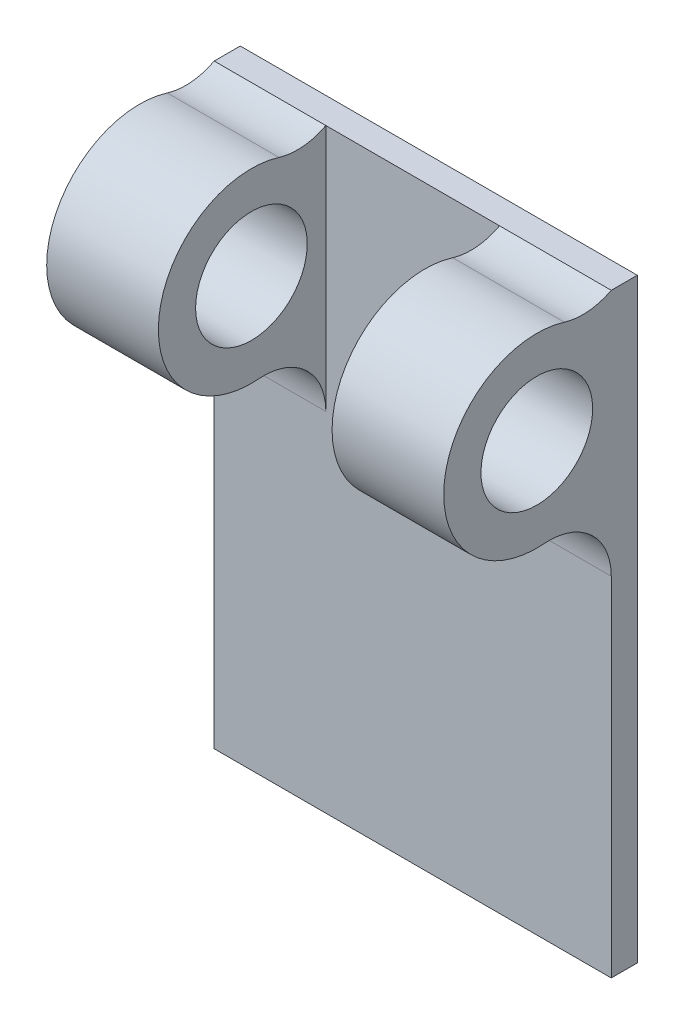
from build123d import *

# Parameters (mm, degrees)
SKETCH1_W           = 640
SKETCH1_H           = 960
BOSS_EXTRUDE1_DEPTH = 42
SKETCH2_R           = 150
SKETCH2_R_2         = 90
BOSS_EXTRUDE2_DEPTH = 640
FILLET1_R           = 100
SKETCH3_W           = 280
SKETCH3_H           = 331.142467373
CUT_EXTRUDE1_DEPTH  = 1053


with BuildPart() as part:
    # Sketch1 → Boss-Extrude1 (new body)
    with BuildSketch(Plane.XY):
        with Locations((320, -480)):
            Rectangle(SKETCH1_W, SKETCH1_H)
    extrude(amount=BOSS_EXTRUDE1_DEPTH)

    # Sketch2 → Boss-Extrude2 (add)
    with BuildSketch(Plane.ZY):
        with Locations((162, -150)):
            Circle(SKETCH2_R)
        with Locations(Location((162, -150, 0), (0, 0, 270))):
            Circle(SKETCH2_R_2, mode=Mode.SUBTRACT)
    extrude(amount=-BOSS_EXTRUDE2_DEPTH)

    # Fillet1
    # the kernel refuses this fillet: 100 mm, written as the material it adds along each edge
    with BuildSketch(Plane(origin=(640, -240, 42), x_dir=(0, -0.48266089642206267, 0.8758073184582617), z_dir=(-1, 0, 0))) as fillet1_piece_1:
        with BuildLine():
            CenterArc((164.419726765, -91.161310821), FILLET1_R, 114.270768309, 94.588565736)
            Line((76.83899492, -139.427400463), (75.087380283, -140.392722256))
            Line((75.087380283, -140.392722256), (-1.751614637, -0.965321793))
            Line((-1.751614637, -0.965321793), (0.822098634, 1.823226216))
            ThreePointArc((0.822098634, 1.823226216), (61.657397537, -11.258033768), (122.49269644, 1.823226216))
            Line((122.49269644, 1.823226216), (123.314795074, 0))
        make_face()
    extrude(amount=640)
    with BuildSketch(Plane(origin=(640, -60, 42), x_dir=(0, 1, 0), z_dir=(-1, 0, 0))) as fillet1_piece_2:
        with BuildLine():
            CenterArc((148.795078393, -45.993847992), FILLET1_R, 152.616862204, 44.602125316)
            Line((53.277047036, -75.596308795), (51.366686409, -76.188358011))
            ThreePointArc((51.366686409, -76.188358011), (30.975334969, -34.741755066), (-1.2, -1.6))
            Line((-1.2, -1.6), (0, 2))
            ThreePointArc((0, 2), (30, 2), (58.224098432, 0.91987696))
            Line((58.224098432, 0.91987696), (60, 0))
        make_face()
    extrude(amount=640)

    # Sketch3 → Cut-Extrude1 (cut)
    with BuildSketch(Plane.XZ.offset(960)):
        with Locations((320, 207.571233687)):
            Rectangle(SKETCH3_W, SKETCH3_H)
    extrude(amount=-CUT_EXTRUDE1_DEPTH, mode=Mode.SUBTRACT)


solid = part.part
